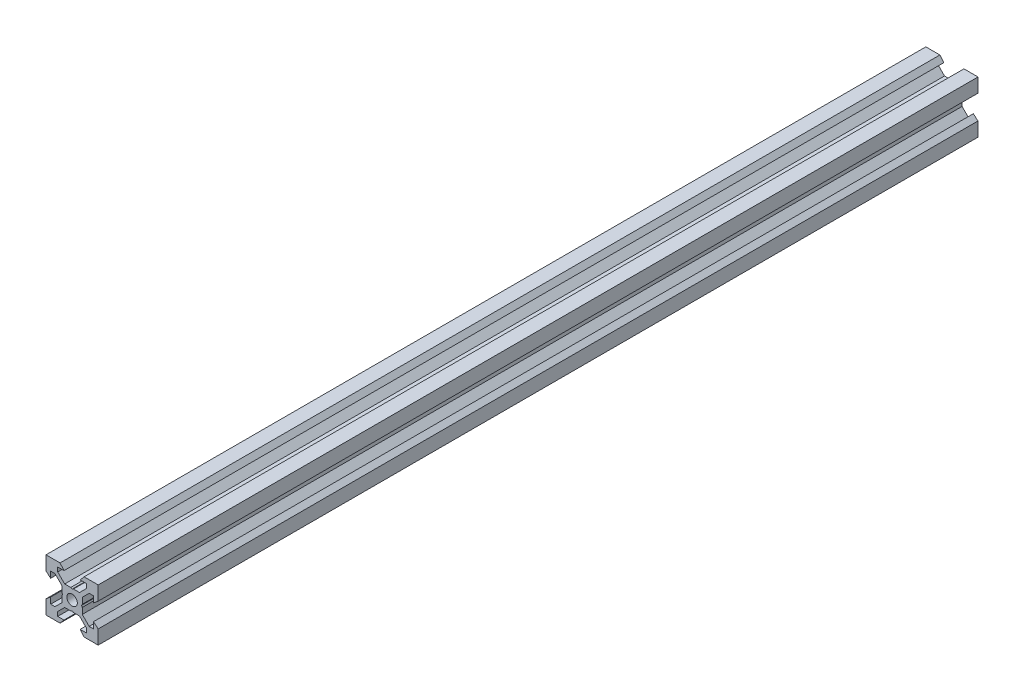
from build123d import *

# Parameters (mm, degrees)
SKETCH1_R           = 2
BOSS_EXTRUDE1_DEPTH = 168.665


with BuildPart() as part:
    # Sketch1 → Boss-Extrude1 (new, symmetric)
    with BuildSketch(Plane.XY):
        Polygon((10, 4.610379336), (10, 10), (4.610379336, 10), (3.1, 8.2), (5.5, 8.2), (5.5, 6.560660172), (2.839339828, 3.9), (0.519615242, 3.9), (0, 3.6), (-0.519615242, 3.9), (-2.839339828, 3.9), (-5.5, 6.560660172), (-5.5, 8.2), (-3.1, 8.2), (-4.610379336, 10), (-10, 10), (-10, 4.610379336), (-8.2, 3.1), (-8.2, 5.5), (-6.560660172, 5.5), (-3.9, 2.839339828), (-3.9, 0.519615242), (-3.6, 0), (-3.9, -0.519615242), (-3.9, -2.839339828), (-6.560660172, -5.5), (-8.2, -5.5), (-8.2, -3.1), (-10, -4.610379336), (-10, -10), (-4.610379336, -10), (-3.1, -8.2), (-5.5, -8.2), (-5.5, -6.560660172), (-2.839339828, -3.9), (-0.519615242, -3.9), (0, -3.6), (0.519615242, -3.9), (2.839339828, -3.9), (5.5, -6.560660172), (5.5, -8.2), (3.1, -8.2), (4.610379336, -10), (10, -10), (10, -4.610379336), (8.2, -3.1), (8.2, -5.5), (6.560660172, -5.5), (3.9, -2.839339828), (3.9, -0.519615242), (3.6, 0), (3.9, 0.519615242), (3.9, 2.839339828), (6.560660172, 5.5), (8.2, 5.5), (8.2, 3.1), align=None)
        Circle(SKETCH1_R, mode=Mode.SUBTRACT)
    extrude(amount=BOSS_EXTRUDE1_DEPTH, both=True)


solid = part.part
